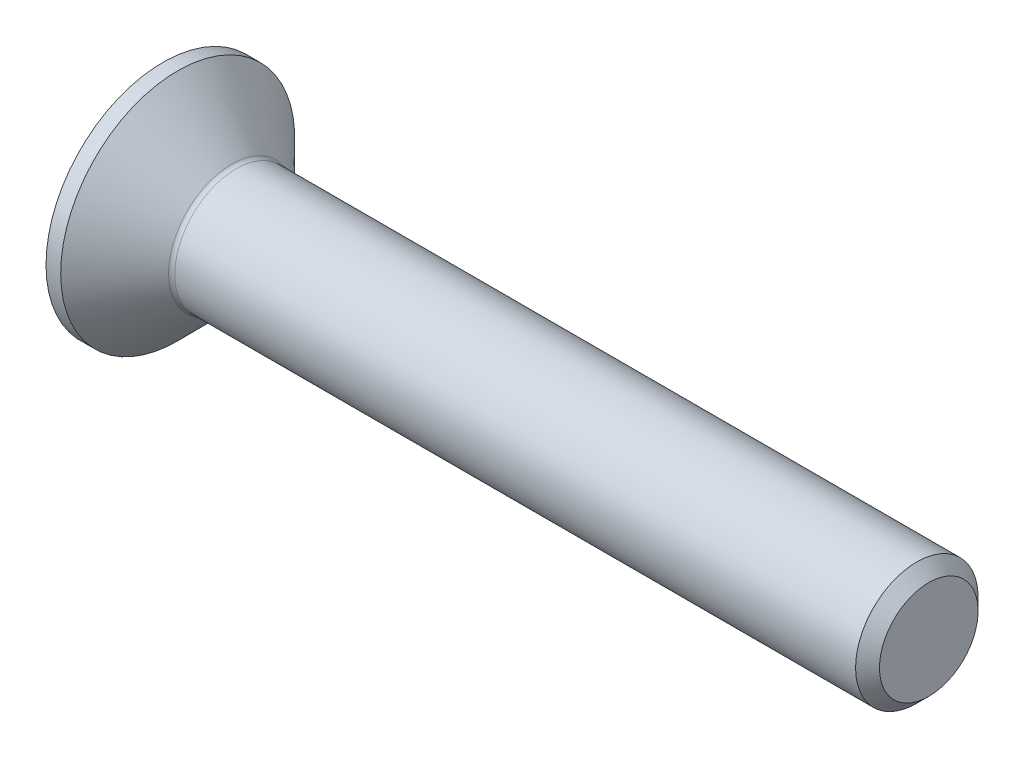
from build123d import *

# Parameters (mm, degrees)
FILLET1_R   = 0.2
HEX_START   = -1.8
HEX_2_DEPTH = 1.8


with BuildPart() as part:
    # BodySke → BaseBody (revolve)
    with BuildSketch(Plane.XY, mode=Mode.PRIVATE) as basebody_sk:
        Polygon((0, 0), (0, 3.82), (0.48, 3.82), (2.3, 2), (24.61, 2), (25, 1.61), (25, 0), align=None)
    revolve(basebody_sk.sketch.rotate(Axis((0, 0, 0), (1, 0, 0)), 90), axis=Axis((0, 0, 0), (1, 0, 0)))

    # Fillet1
    fillet1_edges = [part.edges().sort_by_distance(p)[0] for p in [
        (2.3, 0, -2),
    ]]
    fillet(fillet1_edges, radius=FILLET1_R)

    # Hex 2: read off the stored shape, not the designer's step
    # Hex 2 outline → Hex 2 (cut)
    with BuildSketch(Plane.ZY.offset(HEX_START)):
        Polygon((-1.26, -0.727461339), (0, -1.454922678), (1.26, -0.727461339), (1.26, 0.727461339), (0, 1.454922678), (-1.26, 0.727461339), align=None)
    extrude(amount=HEX_2_DEPTH, mode=Mode.SUBTRACT)

    # Hex 2 2 outline → Hex 2 2 (revolve, cut)
    with BuildSketch(Plane.YX):
        Polygon((1.26, 1.8), (0, 2.527461339), (0, 1.8), align=None)
    revolve(axis=Axis((0, 0, 0), (1, 0, 0)), mode=Mode.SUBTRACT)


solid = part.part
